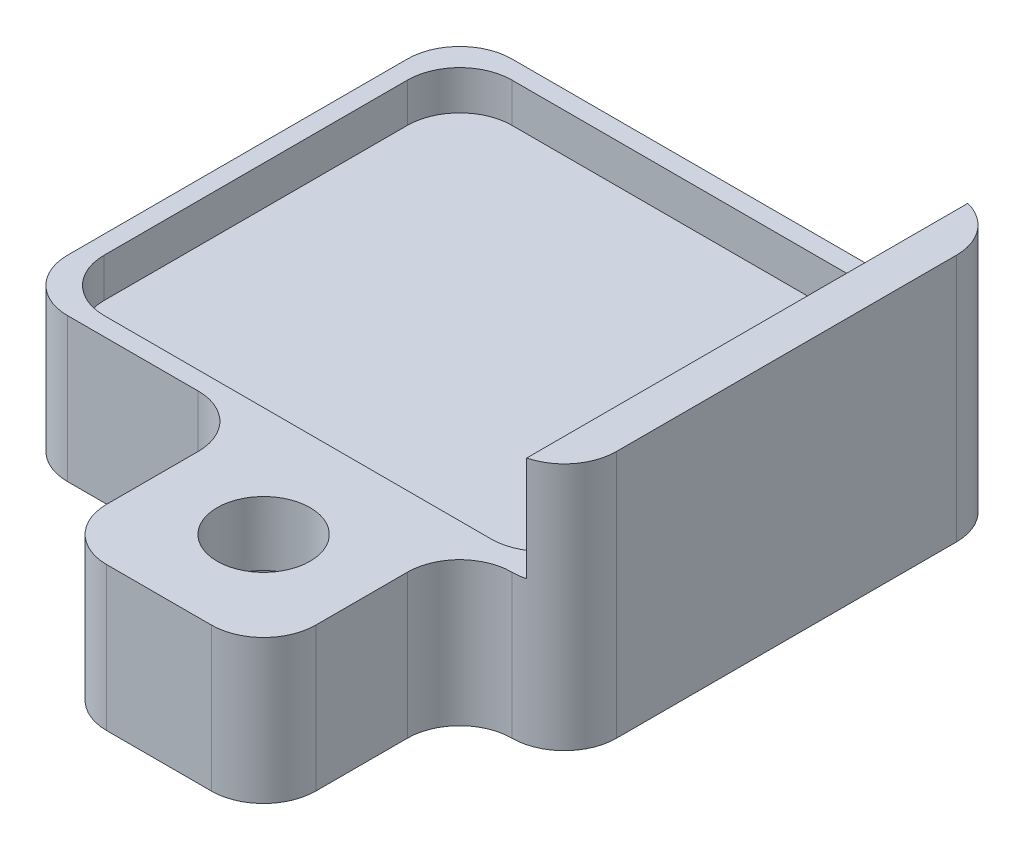
from build123d import *

# Parameters (mm, degrees)
SKETCH1_W                                      = 10.5
SKETCH1_H                                      = 8.5
EXTRUDE1_DEPTH                                 = 4.75
SKETCH3_W                                      = 9.75
SKETCH3_H                                      = 8.5
EXTRUDE4_DEPTH                                 = 2
SKETCH4_W                                      = 9.4
SKETCH4_H                                      = 7.8
EXTRUDE5_DEPTH                                 = 0.75
SKETCH5_W                                      = 4
SKETCH5_H                                      = 2.75
EXTRUDE6_DEPTH                                 = 3.75
CBORE_FOR_0_SOCKET_HEAD_CAP_SCREW1_D           = 1.778
CBORE_FOR_0_SOCKET_HEAD_CAP_SCREW1_CBORE_D     = 3.175
CBORE_FOR_0_SOCKET_HEAD_CAP_SCREW1_CBORE_DEPTH = 1.524
FILLET1_R                                      = 1


with BuildPart() as part:
    # Sketch1 → Extrude1 (new body)
    with BuildSketch(Plane(origin=(0, 0, 0), x_dir=(1, 0, 0), z_dir=(0, 1, 0))):
        Rectangle(SKETCH1_W, SKETCH1_H)
    extrude(amount=EXTRUDE1_DEPTH)

    # Sketch3 → Extrude4 (cut)
    with BuildSketch(Plane(origin=(0, 4.75, 0), x_dir=(1, 0, 0), z_dir=(0, 1, 0))):
        with Locations((-0.375, 0)):
            Rectangle(SKETCH3_W, SKETCH3_H)
    extrude(amount=-EXTRUDE4_DEPTH, mode=Mode.SUBTRACT)

    # Sketch4 → Extrude5 (cut)
    with BuildSketch(Plane(origin=(0, 2.75, 0), x_dir=(1, 0, 0), z_dir=(0, 1, 0))):
        with Locations((-0.2, 0)):
            Rectangle(SKETCH4_W, SKETCH4_H)
    extrude(amount=-EXTRUDE5_DEPTH, mode=Mode.SUBTRACT)

    # Sketch5 → Extrude6 (add)
    with BuildSketch(Plane.XY.offset(4.25)):
        with Locations((1.25, 1.375)):
            Rectangle(SKETCH5_W, SKETCH5_H)
    extrude(amount=EXTRUDE6_DEPTH)

    # CBORE for #0 Socket Head Cap Screw1 (through all)
    with Locations(Plane(origin=(1.25, 0, 6), x_dir=(0, 0, -1), z_dir=(0, -1, 0))):
        with Locations((0, 0)):
            CounterBoreHole(CBORE_FOR_0_SOCKET_HEAD_CAP_SCREW1_D / 2, CBORE_FOR_0_SOCKET_HEAD_CAP_SCREW1_CBORE_D / 2, CBORE_FOR_0_SOCKET_HEAD_CAP_SCREW1_CBORE_DEPTH)

    # Fillet1
    # the kernel refuses this fillet: 1 mm, written as the material it adds along each edge
    with BuildSketch(Plane(origin=(3.25, 2.75, 4.25), x_dir=(0, 0, 1), z_dir=(0, -1, 0))) as fillet1_piece_1:
        with BuildLine():
            CenterArc((FILLET1_R, -FILLET1_R), FILLET1_R, 90, 90)
            Line((0, -FILLET1_R), (0, 0))
            Line((0, 0), (FILLET1_R, 0))
        make_face()
    extrude(amount=2.75)
    with BuildSketch(Plane(origin=(-0.75, 0, 4.25), x_dir=(-1, 0, 0), z_dir=(0, 1, 0))) as fillet1_piece_2:
        with BuildLine():
            CenterArc((FILLET1_R, FILLET1_R), FILLET1_R, 180, 90)
            Line((0, FILLET1_R), (0, 0))
            Line((0, 0), (FILLET1_R, 0))
        make_face()
    extrude(amount=2.75)
    with BuildSketch(Plane(origin=(4.5, 2.75, -3.9), x_dir=(0, 0, 1), z_dir=(0, -1, 0)), Plane(origin=(-4.9, 2.75, -3.9), x_dir=(1, 0, 0), z_dir=(0, -1, 0)), Plane(origin=(-4.9, 2.75, 3.9), x_dir=(0, 0, -1), z_dir=(0, -1, 0))) as fillet1_piece_3:
        with BuildLine():
            CenterArc((FILLET1_R, FILLET1_R), FILLET1_R, 180, 90)
            Line((0, FILLET1_R), (0, 0))
            Line((0, 0), (FILLET1_R, 0))
        make_face()
    extrude(amount=0.75)
    with BuildSketch(Plane(origin=(4.5, 2.75, 3.9), x_dir=(0, 0, -1), z_dir=(0, -1, 0))) as fillet1_piece_4:
        with BuildLine():
            CenterArc((FILLET1_R, -FILLET1_R), FILLET1_R, 90, 90)
            Line((0, -FILLET1_R), (0, 0))
            Line((0, 0), (FILLET1_R, 0))
        make_face()
    extrude(amount=0.75)
    # the kernel refuses this fillet: 1 mm, written as the material it takes off along each edge
    with BuildSketch(Plane(origin=(5.25, -2.5, -4.25), x_dir=(-1, 0, 0), z_dir=(0, 1, 0)), Plane(origin=(5.25, -2.5, 4.25), x_dir=(0, 0, -1), z_dir=(0, 1, 0))) as fillet1_2_piece_1:
        with BuildLine():
            CenterArc((FILLET1_R, FILLET1_R), FILLET1_R, 180, 90)
            Line((0, FILLET1_R), (0, 0))
            Line((0, 0), (FILLET1_R, 0))
        make_face()
    extrude(amount=9.75, mode=Mode.SUBTRACT)
    with BuildSketch(Plane(origin=(3.25, 5.25, 8), x_dir=(0, 0, -1), z_dir=(0, -1, 0))) as fillet1_2_piece_2:
        with BuildLine():
            CenterArc((FILLET1_R, -FILLET1_R), FILLET1_R, 90, 90)
            Line((0, -FILLET1_R), (0, 0))
            Line((0, 0), (FILLET1_R, 0))
        make_face()
    extrude(amount=7.75, mode=Mode.SUBTRACT)
    with BuildSketch(Plane(origin=(-0.75, -2.5, 8), x_dir=(1, 0, 0), z_dir=(0, 1, 0)), Plane(origin=(-5.25, -2.5, -4.25), x_dir=(0, 0, 1), z_dir=(0, 1, 0)), Plane(origin=(-5.25, -2.5, 4.25), x_dir=(1, 0, 0), z_dir=(0, 1, 0))) as fillet1_2_piece_3:
        with BuildLine():
            CenterArc((FILLET1_R, FILLET1_R), FILLET1_R, 180, 90)
            Line((0, FILLET1_R), (0, 0))
            Line((0, 0), (FILLET1_R, 0))
        make_face()
    extrude(amount=7.75, mode=Mode.SUBTRACT)


solid = part.part
